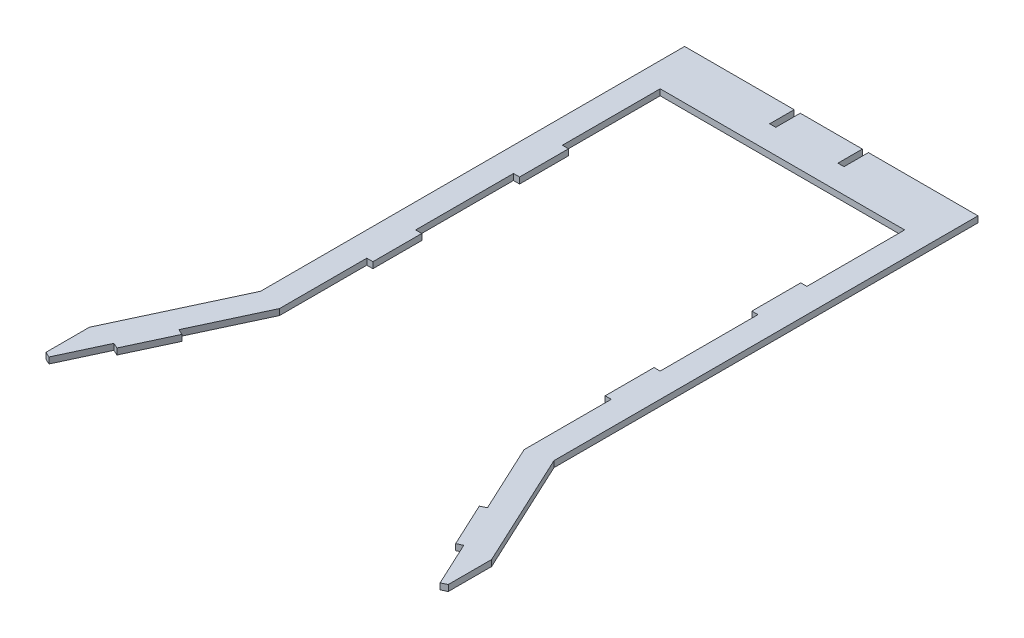
from build123d import *

# Parameters (mm, degrees)
BASE_FLANGE1_DEPTH = 3.175
SKETCH7_W          = 3.175
SKETCH7_H          = 12.7
CUT_EXTRUDE1_DEPTH = 326.126156068
SKETCH12_W         = 3.175
SKETCH12_H         = 25.4
TAB1_DEPTH         = 3.175
CUT_EXTRUDE2_DEPTH = 326.126156068


# Sheet-metal steps are written as plain solids
with BuildPart() as part:
    # Sketch1 → Base-Flange1 (new body)
    with BuildSketch(Plane(origin=(0, 0, 0), x_dir=(1, 0, 0), z_dir=(0, 1, 0))):
        Polygon((-76.2, 0), (76.2, 0), (76.2, -220.278764113), (113.110108895, -299.432748076), (101.6, -304.8), (63.5, -223.094286329), (63.5, -25.4), (-63.5, -25.4), (-63.5, -223.094286329), (-101.6, -304.8), (-113.110108895, -299.432748076), (-76.2, -220.278764113), align=None)
    extrude(amount=-BASE_FLANGE1_DEPTH)

    # Sketch7 → Cut-Extrude1 (cut, through all)
    with BuildSketch(Plane(origin=(0, 0, 0), x_dir=(1, 0, 0), z_dir=(0, 1, 0))):
        with Locations((-17.7165, -6.35)):
            Rectangle(SKETCH7_W, SKETCH7_H)
        with Locations((17.7165, -6.35)):
            Rectangle(SKETCH7_W, SKETCH7_H)
    extrude(amount=-CUT_EXTRUDE1_DEPTH, mode=Mode.SUBTRACT)

    # Sketch12 → Tab1 (add)
    with BuildSketch(Plane(origin=(0, 0, 0), x_dir=(1, 0, 0), z_dir=(0, 1, 0))):
        with Locations((-61.9125, -88.9)):
            Rectangle(SKETCH12_W, SKETCH12_H)
        Polygon((-80.130992304, -258.759564419), (-90.865496152, -281.779782209), (-87.987968928, -283.12159519), (-77.25346508, -260.1013774), align=None)
        with Locations((-61.9125, -165.1)):
            Rectangle(SKETCH12_W, SKETCH12_H)
        Polygon((77.25346508, -260.1013774), (87.987968928, -283.12159519), (90.865496152, -281.779782209), (80.130992304, -258.759564419), align=None)
        with Locations((61.9125, -165.1)):
            Rectangle(SKETCH12_W, SKETCH12_H)
        with Locations((61.9125, -88.9)):
            Rectangle(SKETCH12_W, SKETCH12_H)
    extrude(amount=-TAB1_DEPTH)

    # Sketch13 → Cut-Extrude2 (cut, through all)
    with BuildSketch(Plane(origin=(0, 0, 0), x_dir=(1, 0, 0), z_dir=(0, 1, 0))):
        Polygon((-104.477527224, -303.458187019), (-104.477527224, -280.920116939), (-113.110108895, -299.432748076), align=None)
        Polygon((104.477527224, -303.458187019), (104.477527224, -280.920116939), (113.110108895, -299.432748076), align=None)
    extrude(amount=-CUT_EXTRUDE2_DEPTH, mode=Mode.SUBTRACT)


solid = part.part
